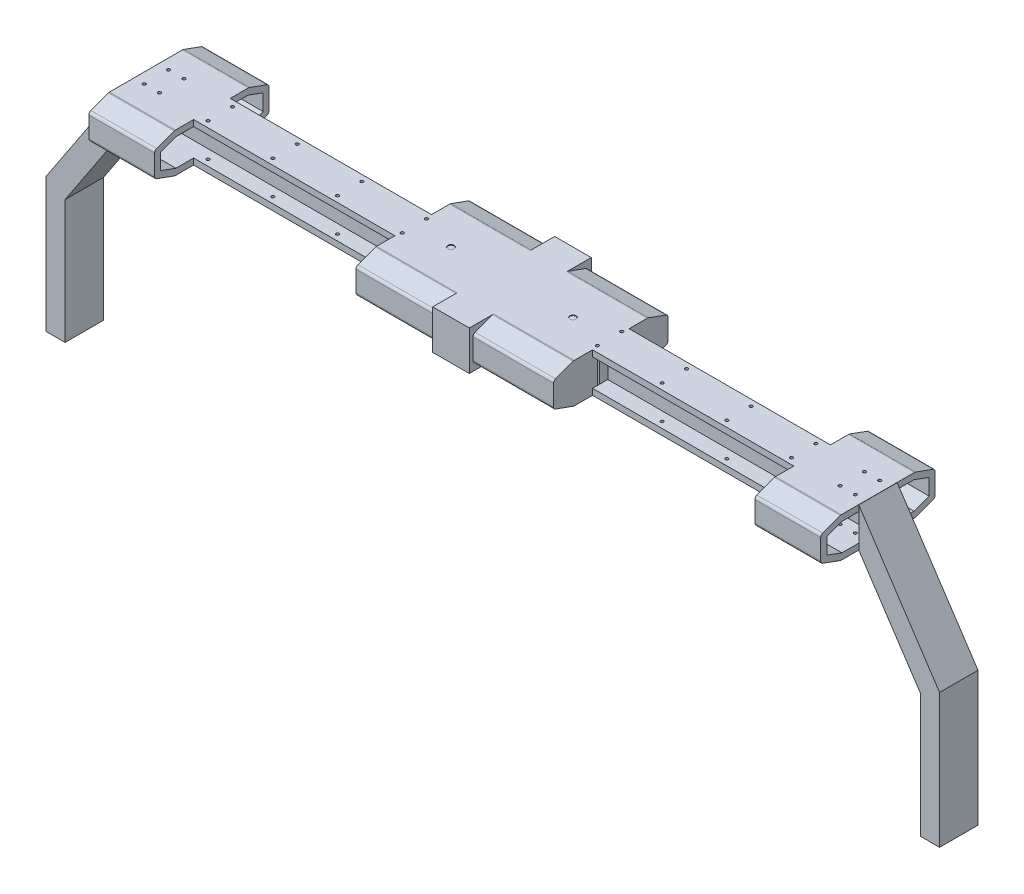
from build123d import *

# Parameters (mm, degrees)
BOSS_EXTRUDE1_DEPTH = 600
SKETCH10_W          = 30
SKETCH10_H          = 200
BOSS_EXTRUDE5_DEPTH = 26
SKETCH6_W           = 30
SKETCH6_H           = 200
BOSS_EXTRUDE3_DEPTH = 64.63
BOSS_EXTRUDE4_DEPTH = 132
EXTRUDE_THIN1_START = -108
EXTRUDE_THIN1_DEPTH = 108
BOSS_EXTRUDE2_DEPTH = 31.5
SKETCH2_R           = 2.5
CUT_EXTRUDE1_DEPTH  = 851.471375008
SKETCH12_R          = 5
CUT_EXTRUDE2_DEPTH  = 1


# Read off the part's stored shape, not the designer's step: Extrude-Thin1
with BuildPart() as part:
    # Sketch1 → Boss-Extrude1 (new body)
    with BuildSketch(Plane(origin=(0, 0, 0), x_dir=(0, 0, -1), z_dir=(1, 0, 0))):
        Polygon((30, 32.315), (-30, 32.315), (-30, 22.315), (-5, 22.315), (-5, -22.315), (-30, -22.315), (-30, -32.315), (30, -32.315), (30, -22.315), (5, -22.315), (5, 22.315), (30, 22.315), align=None)
    extrude(amount=BOSS_EXTRUDE1_DEPTH)

    # Sketch10 → Boss-Extrude5 (add, symmetric)
    with BuildSketch(Plane(origin=(0, 0, 0), x_dir=(1, 0, 0), z_dir=(0, 1, 0))):
        with Locations((15, 0)):
            Rectangle(SKETCH10_W, SKETCH10_H)
    extrude(amount=BOSS_EXTRUDE5_DEPTH, both=True)

    # Sketch6 → Boss-Extrude3 (add)
    with BuildSketch(Plane(origin=(0, 32.315, 0), x_dir=(1, 0, 0), z_dir=(0, 1, 0))):
        with Locations((15, 0)):
            Rectangle(SKETCH6_W, SKETCH6_H)
    extrude(amount=-BOSS_EXTRUDE3_DEPTH)

    # Sketch7 → Boss-Extrude4 (add)
    with BuildSketch(Plane(origin=(30, 0, 0), x_dir=(0, 0, -1), z_dir=(1, 0, 0))):
        with BuildLine():
            ThreePointArc((60.795080716, 32.239038765), (60.362618542, 32.29597349), (59.926839828, 32.315))
            Line((59.926839828, 32.315), (-59.926839828, 32.315))
            ThreePointArc((-59.926839828, 32.315), (-60.362618542, 32.29597349), (-60.795080716, 32.239038765))
            ThreePointArc((-60.795080716, 32.239038765), (-61.22632911, 32.164760023), (-61.636940545, 32.013463104))
            Line((-61.636940545, 32.013463104), (-90.590100717, 21.475374613))
            ThreePointArc((-90.590100717, 21.475374613), (-92.975760221, 19.644793691), (-93.88, 16.776911509))
            Line((-93.88, 16.776911509), (-93.88, 5.269436316))
            Line((-93.88, 5.269436316), (-93.88, -5.269436316))
            Line((-93.88, -5.269436316), (-93.88, -16.776911509))
            ThreePointArc((-93.88, -16.776911509), (-92.975760221, -19.644793691), (-90.590100717, -21.475374613))
            Line((-90.590100717, -21.475374613), (-61.636940545, -32.013463104))
            ThreePointArc((-61.636940545, -32.013463104), (-61.22632911, -32.164760023), (-60.795080716, -32.239038765))
            ThreePointArc((-60.795080716, -32.239038765), (-60.362618542, -32.29597349), (-59.926839828, -32.315))
            Line((-59.926839828, -32.315), (59.926839828, -32.315))
            ThreePointArc((59.926839828, -32.315), (60.362618542, -32.29597349), (60.795080716, -32.239038765))
            ThreePointArc((60.795080716, -32.239038765), (61.22632911, -32.164760023), (61.636940545, -32.013463104))
            Line((61.636940545, -32.013463104), (90.590100717, -21.475374613))
            ThreePointArc((90.590100717, -21.475374613), (92.975760221, -19.644793691), (93.88, -16.776911509))
            Line((93.88, -16.776911509), (93.88, -5.269436316))
            Line((93.88, -5.269436316), (93.88, 5.269436316))
            Line((93.88, 5.269436316), (93.88, 16.776911509))
            ThreePointArc((93.88, 16.776911509), (92.975760221, 19.644793691), (90.590100717, 21.475374613))
            Line((90.590100717, 21.475374613), (61.636940545, 32.013463104))
            ThreePointArc((61.636940545, 32.013463104), (61.22632911, 32.164760023), (60.795080716, 32.239038765))
        make_face()
    extrude(amount=BOSS_EXTRUDE4_DEPTH)

    # Extrude-Thin1 outline → Extrude-Thin1 (add)
    with BuildSketch(Plane(origin=(600, 0, 0), x_dir=(0, 0, -1), z_dir=(1, 0, 0)).offset(EXTRUDE_THIN1_START)):
        with BuildLine():
            Line((59.045204925, -22.315), (30, -22.315))
            Line((30, -22.315), (30, -32.315))
            Line((30, -32.315), (59.926839828, -32.315))
            ThreePointArc((59.926839828, -32.315), (60.362618542, -32.29597349), (60.795080716, -32.239038765))
            ThreePointArc((60.795080716, -32.239038765), (61.22632911, -32.164760023), (61.636940545, -32.013463104))
            Line((61.636940545, -32.013463104), (90.590100717, -21.475374613))
            ThreePointArc((90.590100717, -21.475374613), (92.975760221, -19.644793691), (93.88, -16.776911509))
            Line((93.88, -16.776911509), (93.88, 16.776911509))
            ThreePointArc((93.88, 16.776911509), (92.975760221, 19.644793691), (90.590100717, 21.475374613))
            Line((90.590100717, 21.475374613), (61.636940545, 32.013463104))
            ThreePointArc((61.636940545, 32.013463104), (61.22632911, 32.164760023), (60.795080716, 32.239038765))
            ThreePointArc((60.795080716, 32.239038765), (60.362618542, 32.29597349), (59.926839828, 32.315))
            Line((59.926839828, 32.315), (30, 32.315))
            Line((30, 32.315), (30, 22.315))
            Line((30, 22.315), (59.045204925, 22.315))
            Line((59.045204925, 22.315), (83.88, 13.275873818))
            Line((83.88, 13.275873818), (83.88, -13.275873818))
            Line((83.88, -13.275873818), (59.045204925, -22.315))
        make_face()
        with BuildLine():
            Line((-59.926839828, -32.315), (-30, -32.315))
            Line((-30, -32.315), (-30, -22.315))
            Line((-30, -22.315), (-59.045204925, -22.315))
            Line((-59.045204925, -22.315), (-83.88, -13.275873818))
            Line((-83.88, -13.275873818), (-83.88, 13.275873818))
            Line((-83.88, 13.275873818), (-59.045204925, 22.315))
            Line((-59.045204925, 22.315), (-30, 22.315))
            Line((-30, 22.315), (-30, 32.315))
            Line((-30, 32.315), (-59.926839828, 32.315))
            ThreePointArc((-59.926839828, 32.315), (-60.362618542, 32.29597349), (-60.795080716, 32.239038765))
            ThreePointArc((-60.795080716, 32.239038765), (-61.22632911, 32.164760023), (-61.636940545, 32.013463104))
            Line((-61.636940545, 32.013463104), (-90.590100717, 21.475374613))
            ThreePointArc((-90.590100717, 21.475374613), (-92.975760221, 19.644793691), (-93.88, 16.776911509))
            Line((-93.88, 16.776911509), (-93.88, -16.776911509))
            ThreePointArc((-93.88, -16.776911509), (-92.975760221, -19.644793691), (-90.590100717, -21.475374613))
            Line((-90.590100717, -21.475374613), (-61.636940545, -32.013463104))
            ThreePointArc((-61.636940545, -32.013463104), (-61.22632911, -32.164760023), (-60.795080716, -32.239038765))
            ThreePointArc((-60.795080716, -32.239038765), (-60.362618542, -32.29597349), (-59.926839828, -32.315))
        make_face()
    extrude(amount=EXTRUDE_THIN1_DEPTH)

    # Sketch3 → Boss-Extrude2 (add, symmetric)
    with BuildSketch(Plane.XY):
        Polygon((600, 32.013463104), (732.5, -168.095882005), (732.5, -388.095882005), (701.241539507, -388.095882005), (701.241539507, -185.215967309), (600, -32.315), align=None)
    extrude(amount=BOSS_EXTRUDE2_DEPTH, both=True)

    # Sketch2 → Cut-Extrude1 (cut, through all)
    with BuildSketch(Plane(origin=(0, 32.315, 0), x_dir=(1, 0, 0), z_dir=(0, 1, 0))):
        with Locations(Location((160, 20, 0), (0, 0, 270))):
            Circle(SKETCH2_R)
        with Locations(Location((160, -20, 0), (0, 0, 270))):
            Circle(SKETCH2_R)
        with Locations(Location((266.07, 20, 0), (0, 0, 270))):
            Circle(SKETCH2_R)
        with Locations(Location((266.07, -20, 0), (0, 0, 270))):
            Circle(SKETCH2_R)
        with Locations(Location((583, 20, 0), (0, 0, 270))):
            Circle(SKETCH2_R)
        with Locations(Location((558, 20, 0), (0, 0, 270))):
            Circle(SKETCH2_R)
        with Locations(Location((583, -20, 0), (0, 0, 270))):
            Circle(SKETCH2_R)
        with Locations(Location((558, -20, 0), (0, 0, 270))):
            Circle(SKETCH2_R)
        with Locations(Location((372.14, 20, 0), (0, 0, 270))):
            Circle(SKETCH2_R)
        with Locations(Location((372.14, -20, 0), (0, 0, 270))):
            Circle(SKETCH2_R)
        with Locations(Location((478.21, -20, 0), (0, 0, 270))):
            Circle(SKETCH2_R)
        with Locations(Location((478.21, 20, 0), (0, 0, 270))):
            Circle(SKETCH2_R)
    extrude(amount=-CUT_EXTRUDE1_DEPTH, mode=Mode.SUBTRACT)

    # Sketch12 → Cut-Extrude2 (cut)
    with BuildSketch(Plane(origin=(0, 32.315, 0), x_dir=(1, 0, 0), z_dir=(0, 1, 0))):
        with Locations((-100, 0)):
            Circle(SKETCH12_R)
        with Locations(Location((100, 0, 0), (0, 0, 270))):
            Circle(SKETCH12_R)
    extrude(amount=-CUT_EXTRUDE2_DEPTH, mode=Mode.SUBTRACT)

    # Mirror2: part across face


with BuildPart() as part_1:
    add(part.part)
    add(part.part.mirror(Plane.ZY))


solid = part_1.part
